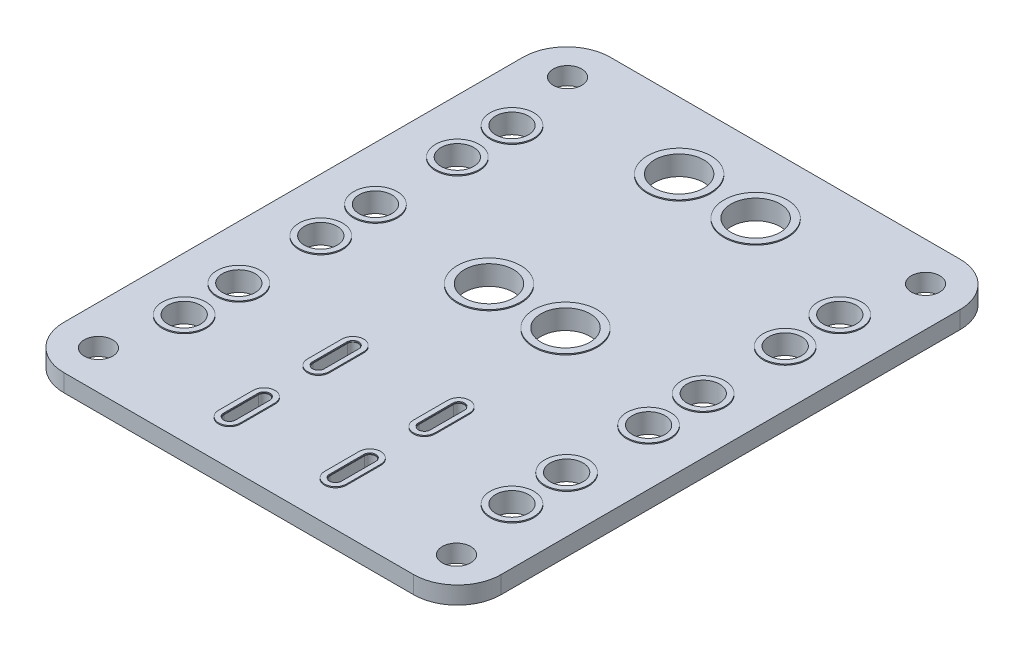
from build123d import *

# Parameters (mm, degrees)
SALIENTE_EXTRUIR1_DEPTH    = 0.8
CORTAR_EXTRUIR1_DEPTH      = 33.055576738
CORTAR_EXTRUIR1_DEPTH_BACK = 33.055576738
CROQUIS2_R                 = 1.3
CROQUIS6_R                 = 2.25
CROQUIS6_R_2               = 1.5
CORTAR_EXTRUIR3_DEPTH      = 33.055576738
CROQUIS7_R                 = 2
CROQUIS7_R_2               = 1.5
CROQUIS7_R_3               = 2.894896359
CROQUIS7_R_4               = 2.25
SALIENTE_EXTRUIR3_DEPTH    = 0.9


with BuildPart() as part:
    # Croquis1 → Saliente-Extruir1 (new, symmetric)
    with BuildSketch(Plane(origin=(0, 0, 0), x_dir=(1, 0, 0), z_dir=(0, 1, 0))):
        with BuildLine():
            Line((-16, 25), (16, 25))
            ThreePointArc((16, 25), (18.828427125, 23.828427125), (20, 21))
            Line((20, 21), (20, -21))
            ThreePointArc((20, -21), (18.828427125, -23.828427125), (16, -25))
            Line((16, -25), (-16, -25))
            ThreePointArc((-16, -25), (-18.828427125, -23.828427125), (-20, -21))
            Line((-20, -21), (-20, 21))
            ThreePointArc((-20, 21), (-18.828427125, 23.828427125), (-16, 25))
        make_face()
    extrude(amount=SALIENTE_EXTRUIR1_DEPTH, both=True)

    # Croquis2 → Cortar-Extruir1 (cut, two sides: drawn at the far end of the back side and taken through both)
    with BuildSketch(Plane(origin=(0, 0.8, 0), x_dir=(1, 0, 0), z_dir=(0, 1, 0)).offset(-CORTAR_EXTRUIR1_DEPTH_BACK)):
        with Locations((-16.383, 21.463)):
            Circle(CROQUIS2_R)
        with Locations((16.383, 21.463)):
            Circle(CROQUIS2_R)
        with Locations((16.383, -21.463)):
            Circle(CROQUIS2_R)
        with Locations((-16.383, -21.463)):
            Circle(CROQUIS2_R)
    extrude(amount=CORTAR_EXTRUIR1_DEPTH + CORTAR_EXTRUIR1_DEPTH_BACK, mode=Mode.SUBTRACT)

    # Croquis6 → Cortar-Extruir3 (cut, through all)
    with BuildSketch(Plane(origin=(0, 0.8, 0), x_dir=(1, 0, 0), z_dir=(0, 1, 0))):
        with Locations((-3.5, 18.796)):
            Circle(CROQUIS6_R)
        with Locations((3.5, 18.796)):
            Circle(CROQUIS6_R)
        with Locations((-15, 2.5)):
            Circle(CROQUIS6_R_2)
        with Locations((-15, -2.5)):
            Circle(CROQUIS6_R_2)
        with Locations((-15, 10)):
            Circle(CROQUIS6_R_2)
        with Locations((-15, 15)):
            Circle(CROQUIS6_R_2)
        with Locations((-15, -10)):
            Circle(CROQUIS6_R_2)
        with Locations((-15, -15)):
            Circle(CROQUIS6_R_2)
        with Locations((15, -15)):
            Circle(CROQUIS6_R_2)
        with Locations((15, -10)):
            Circle(CROQUIS6_R_2)
        with Locations((15, 15)):
            Circle(CROQUIS6_R_2)
        with Locations((15, 10)):
            Circle(CROQUIS6_R_2)
        with Locations((15, -2.5)):
            Circle(CROQUIS6_R_2)
        with Locations((15, 2.5)):
            Circle(CROQUIS6_R_2)
        with Locations((3.5, 1.397)):
            Circle(CROQUIS6_R)
        with Locations((-3.5, 1.397)):
            Circle(CROQUIS6_R)
        with BuildLine():
            Line((5.347, -9.721), (5.347, -12.871))
            ThreePointArc((5.347, -12.871), (4.847, -13.371), (4.347, -12.871))
            Line((4.347, -12.871), (4.347, -9.721))
            ThreePointArc((4.347, -9.721), (4.847, -9.221), (5.347, -9.721))
        make_face()
        with BuildLine():
            Line((-5.347, -9.721), (-5.347, -12.871))
            ThreePointArc((-5.347, -12.871), (-4.847, -13.371), (-4.347, -12.871))
            Line((-4.347, -12.871), (-4.347, -9.721))
            ThreePointArc((-4.347, -9.721), (-4.847, -9.221), (-5.347, -9.721))
        make_face()
        with BuildLine():
            Line((5.347, -20.999), (5.347, -17.849))
            ThreePointArc((5.347, -17.849), (4.847, -17.349), (4.347, -17.849))
            Line((4.347, -17.849), (4.347, -20.999))
            ThreePointArc((4.347, -20.999), (4.847, -21.499), (5.347, -20.999))
        make_face()
        with BuildLine():
            Line((-5.347, -20.999), (-5.347, -17.849))
            ThreePointArc((-5.347, -17.849), (-4.847, -17.349), (-4.347, -17.849))
            Line((-4.347, -17.849), (-4.347, -20.999))
            ThreePointArc((-4.347, -20.999), (-4.847, -21.499), (-5.347, -20.999))
        make_face()
    extrude(amount=-CORTAR_EXTRUIR3_DEPTH, mode=Mode.SUBTRACT)

    # Croquis7 → Saliente-Extruir3 (add, symmetric)
    # profile 1 of 20: a face of its own
    with BuildSketch(Plane(origin=(0, 0, 0), x_dir=(1, 0, 0), z_dir=(0, 1, 0))):
        with Locations((-15, 15)):
            Circle(CROQUIS7_R)
        with Locations((-15, 15)):
            Circle(CROQUIS7_R_2, mode=Mode.SUBTRACT)
    # profile 2 of 20: a face of its own
    with BuildSketch(Plane(origin=(0, 0, 0), x_dir=(1, 0, 0), z_dir=(0, 1, 0))):
        with Locations((-15, 10)):
            Circle(CROQUIS7_R)
        with Locations((-15, 10)):
            Circle(CROQUIS7_R_2, mode=Mode.SUBTRACT)
    # profile 3 of 20: a face of its own
    with BuildSketch(Plane(origin=(0, 0, 0), x_dir=(1, 0, 0), z_dir=(0, 1, 0))):
        with Locations((-15, 2.5)):
            Circle(CROQUIS7_R)
        with Locations((-15, 2.5)):
            Circle(CROQUIS7_R_2, mode=Mode.SUBTRACT)
    # profile 4 of 20: a face of its own
    with BuildSketch(Plane(origin=(0, 0, 0), x_dir=(1, 0, 0), z_dir=(0, 1, 0))):
        with Locations((-15, -2.5)):
            Circle(CROQUIS7_R)
        with Locations((-15, -2.5)):
            Circle(CROQUIS7_R_2, mode=Mode.SUBTRACT)
    # profile 5 of 20: a face of its own
    with BuildSketch(Plane(origin=(0, 0, 0), x_dir=(1, 0, 0), z_dir=(0, 1, 0))):
        with Locations((-15, -15)):
            Circle(CROQUIS7_R)
        with Locations((-15, -15)):
            Circle(CROQUIS7_R_2, mode=Mode.SUBTRACT)
    # profile 6 of 20: a face of its own
    with BuildSketch(Plane(origin=(0, 0, 0), x_dir=(1, 0, 0), z_dir=(0, 1, 0))):
        with Locations((-15, -10)):
            Circle(CROQUIS7_R)
        with Locations((-15, -10)):
            Circle(CROQUIS7_R_2, mode=Mode.SUBTRACT)
    # profile 7 of 20: a face of its own
    with BuildSketch(Plane(origin=(0, 0, 0), x_dir=(1, 0, 0), z_dir=(0, 1, 0))):
        with Locations((-3.5, 18.796)):
            Circle(CROQUIS7_R_3)
        with Locations((-3.5, 18.796)):
            Circle(CROQUIS7_R_4, mode=Mode.SUBTRACT)
    # profile 8 of 20: a face of its own
    with BuildSketch(Plane(origin=(0, 0, 0), x_dir=(1, 0, 0), z_dir=(0, 1, 0))):
        with Locations((3.5, 18.796)):
            Circle(CROQUIS7_R_3)
        with Locations((3.5, 18.796)):
            Circle(CROQUIS7_R_4, mode=Mode.SUBTRACT)
    # profile 9 of 20: a face of its own
    with BuildSketch(Plane(origin=(0, 0, 0), x_dir=(1, 0, 0), z_dir=(0, 1, 0))):
        with Locations((15, -10)):
            Circle(CROQUIS7_R)
        with Locations((15, -10)):
            Circle(CROQUIS7_R_2, mode=Mode.SUBTRACT)
    # profile 10 of 20: a face of its own
    with BuildSketch(Plane(origin=(0, 0, 0), x_dir=(1, 0, 0), z_dir=(0, 1, 0))):
        with Locations((15, -15)):
            Circle(CROQUIS7_R)
        with Locations((15, -15)):
            Circle(CROQUIS7_R_2, mode=Mode.SUBTRACT)
    # profile 11 of 20: a face of its own
    with BuildSketch(Plane(origin=(0, 0, 0), x_dir=(1, 0, 0), z_dir=(0, 1, 0))):
        with Locations((15, -2.5)):
            Circle(CROQUIS7_R)
        with Locations((15, -2.5)):
            Circle(CROQUIS7_R_2, mode=Mode.SUBTRACT)
    # profile 12 of 20: a face of its own
    with BuildSketch(Plane(origin=(0, 0, 0), x_dir=(1, 0, 0), z_dir=(0, 1, 0))):
        with Locations((15, 2.5)):
            Circle(CROQUIS7_R)
        with Locations((15, 2.5)):
            Circle(CROQUIS7_R_2, mode=Mode.SUBTRACT)
    # profile 13 of 20: a face of its own
    with BuildSketch(Plane(origin=(0, 0, 0), x_dir=(1, 0, 0), z_dir=(0, 1, 0))):
        with Locations((15, 10)):
            Circle(CROQUIS7_R)
        with Locations((15, 10)):
            Circle(CROQUIS7_R_2, mode=Mode.SUBTRACT)
    # profile 14 of 20: a face of its own
    with BuildSketch(Plane(origin=(0, 0, 0), x_dir=(1, 0, 0), z_dir=(0, 1, 0))):
        with Locations((15, 15)):
            Circle(CROQUIS7_R)
        with Locations((15, 15)):
            Circle(CROQUIS7_R_2, mode=Mode.SUBTRACT)
    # profile 15 of 20: a face of its own
    with BuildSketch(Plane(origin=(0, 0, 0), x_dir=(1, 0, 0), z_dir=(0, 1, 0))):
        with Locations((3.5, 1.397)):
            Circle(CROQUIS7_R_3)
        with Locations((3.5, 1.397)):
            Circle(CROQUIS7_R_4, mode=Mode.SUBTRACT)
    # profile 16 of 20: a face of its own
    with BuildSketch(Plane(origin=(0, 0, 0), x_dir=(1, 0, 0), z_dir=(0, 1, 0))):
        with Locations((-3.5, 1.397)):
            Circle(CROQUIS7_R_3)
        with Locations((-3.5, 1.397)):
            Circle(CROQUIS7_R_4, mode=Mode.SUBTRACT)
    # profile 17 of 20: a face of its own
    with BuildSketch(Plane(origin=(0, 0, 0), x_dir=(1, 0, 0), z_dir=(0, 1, 0))):
        with BuildLine():
            Line((-3.847, -12.871), (-3.847, -9.721))
            ThreePointArc((-3.847, -9.721), (-4.847, -8.721), (-5.847, -9.721))
            Line((-5.847, -9.721), (-5.847, -12.871))
            ThreePointArc((-5.847, -12.871), (-4.847, -13.871), (-3.847, -12.871))
        make_face()
        with BuildLine():
            Line((-4.297, -12.871), (-4.297, -9.721))
            ThreePointArc((-4.297, -9.721), (-4.847, -9.171), (-5.397, -9.721))
            Line((-5.397, -9.721), (-5.397, -12.871))
            ThreePointArc((-5.397, -12.871), (-4.847, -13.421), (-4.297, -12.871))
        make_face(mode=Mode.SUBTRACT)
    # profile 18 of 20: a face of its own
    with BuildSketch(Plane(origin=(0, 0, 0), x_dir=(1, 0, 0), z_dir=(0, 1, 0))):
        with BuildLine():
            Line((5.847, -12.871), (5.847, -9.721))
            ThreePointArc((5.847, -9.721), (4.847, -8.721), (3.847, -9.721))
            Line((3.847, -9.721), (3.847, -12.871))
            ThreePointArc((3.847, -12.871), (4.847, -13.871), (5.847, -12.871))
        make_face()
        with BuildLine():
            Line((5.397, -12.871), (5.397, -9.721))
            ThreePointArc((5.397, -9.721), (4.847, -9.171), (4.297, -9.721))
            Line((4.297, -9.721), (4.297, -12.871))
            ThreePointArc((4.297, -12.871), (4.847, -13.421), (5.397, -12.871))
        make_face(mode=Mode.SUBTRACT)
    # profile 19 of 20: a face of its own
    with BuildSketch(Plane(origin=(0, 0, 0), x_dir=(1, 0, 0), z_dir=(0, 1, 0))):
        with BuildLine():
            Line((-5.847, -17.849), (-5.847, -20.999))
            ThreePointArc((-5.847, -20.999), (-4.847, -21.999), (-3.847, -20.999))
            Line((-3.847, -20.999), (-3.847, -17.849))
            ThreePointArc((-3.847, -17.849), (-4.847, -16.849), (-5.847, -17.849))
        make_face()
        with BuildLine():
            Line((-4.297, -20.999), (-4.297, -17.849))
            ThreePointArc((-4.297, -17.849), (-4.847, -17.299), (-5.397, -17.849))
            Line((-5.397, -17.849), (-5.397, -20.999))
            ThreePointArc((-5.397, -20.999), (-4.847, -21.549), (-4.297, -20.999))
        make_face(mode=Mode.SUBTRACT)
    # profile 20 of 20: a face of its own
    with BuildSketch(Plane(origin=(0, 0, 0), x_dir=(1, 0, 0), z_dir=(0, 1, 0))):
        with BuildLine():
            Line((5.847, -20.999), (5.847, -17.849))
            ThreePointArc((5.847, -17.849), (4.847, -16.849), (3.847, -17.849))
            Line((3.847, -17.849), (3.847, -20.999))
            ThreePointArc((3.847, -20.999), (4.847, -21.999), (5.847, -20.999))
        make_face()
        with BuildLine():
            Line((5.397, -20.999), (5.397, -17.849))
            ThreePointArc((5.397, -17.849), (4.847, -17.299), (4.297, -17.849))
            Line((4.297, -17.849), (4.297, -20.999))
            ThreePointArc((4.297, -20.999), (4.847, -21.549), (5.397, -20.999))
        make_face(mode=Mode.SUBTRACT)
    extrude(amount=SALIENTE_EXTRUIR3_DEPTH, both=True)


solid = part.part
